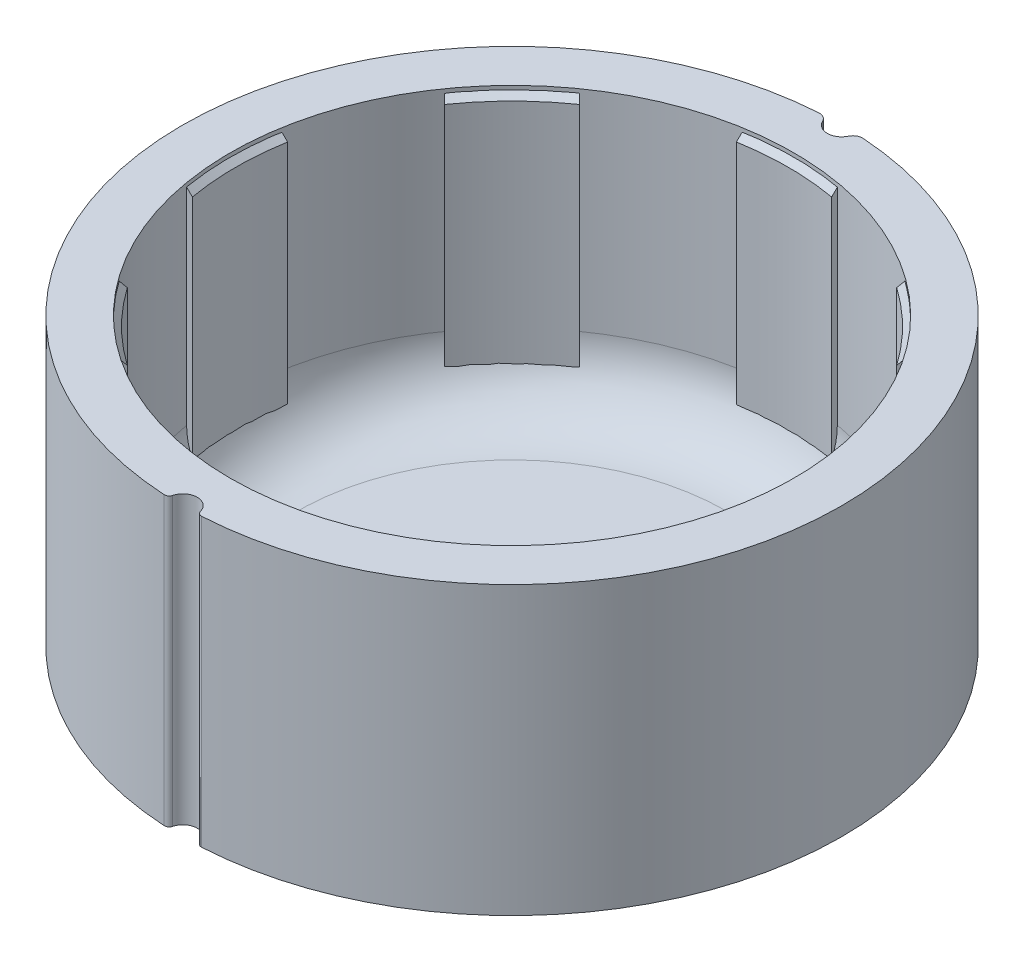
from build123d import *

# Parameters (mm, degrees)
BOSS_EXTRUDE1_DEPTH = 30
CUT_EXTRUDE2_REACH  = 60.241
CUT_EXTRUDE2_START  = 1
SKETCH2_R           = 29.5
BOSS_EXTRUDE2_DEPTH = 30
CHAMFER2_SIZE       = 1
CIRPATTERN2_COUNT   = 8
FILLET2_R           = 7


with BuildPart() as part:
    # Sketch1 → Boss-Extrude1 (new body)
    with BuildSketch(Plane(origin=(0, 0, 0), x_dir=(1, 0, 0), z_dir=(0, 1, 0))):
        with BuildLine():
            ThreePointArc((1.451818925, -34.068556857), (1.641248992, -34.346908706), (1.964225605, -34.442038138))
            ThreePointArc((1.964225605, -34.442038138), (34.499528846, -0.178302888), (2.324135821, 34.423627607))
            ThreePointArc((2.324135821, 34.423627607), (1.751838249, 34.289058819), (1.354061739, 33.856153382))
            ThreePointArc((1.354061739, 33.856153382), (0, 33.001534515), (-1.354061739, 33.856153382))
            ThreePointArc((-1.354061739, 33.856153382), (-1.751838249, 34.289058819), (-2.324135821, 34.423627607))
            ThreePointArc((-2.324135821, 34.423627607), (-34.499528846, -0.178302888), (-1.964225605, -34.442038138))
            ThreePointArc((-1.964225605, -34.442038138), (-1.641248992, -34.346908706), (-1.451818925, -34.068556857))
            ThreePointArc((-1.451818925, -34.068556857), (0, -32.945679925), (1.451818925, -34.068556857))
        make_face()
    extrude(amount=BOSS_EXTRUDE1_DEPTH)

    # Sketch2 → Cut-Extrude2 (cut, up to next)
    with BuildSketch(Plane(origin=(0, 0, 0), x_dir=(1, 0, 0), z_dir=(0, 1, 0)).offset(CUT_EXTRUDE2_START), mode=Mode.PRIVATE) as cut_extrude2_sk1:
        with Locations(Location((0, 0, 0), (0, 0, 270))):
            Circle(SKETCH2_R)
    cut_extrude2_tool1 = extrude(cut_extrude2_sk1.sketch, amount=CUT_EXTRUDE2_REACH, mode=Mode.PRIVATE) & part.part
    add(cut_extrude2_tool1.solids().sort_by_distance((0, 1, 0))[0], mode=Mode.SUBTRACT)

    # Fillet2
    fillet2_edges = [part.edges().sort_by_distance(p)[0] for p in [
        (0, 1, -29.5),
    ]]
    fillet(fillet2_edges, radius=FILLET2_R)


with BuildPart() as body_2:
    # Sketch2<2> → Boss-Extrude2 (new body)
    with BuildSketch(Plane(origin=(0, 0, 0), x_dir=(1, 0, 0), z_dir=(0, 1, 0))):
        with BuildLine():
            ThreePointArc((4.982013036, 29.076271186), (0, 29.5), (-4.982013036, 29.076271186))
            Line((-4.982013036, 29.076271186), (-4.982013036, 28.467341746))
            ThreePointArc((-4.982013036, 28.467341746), (0, 28.9), (4.982013036, 28.467341746))
            Line((4.982013036, 28.467341746), (4.982013036, 29.076271186))
        make_face()
    extrude(amount=BOSS_EXTRUDE2_DEPTH)

    # Chamfer2
    # the kernel refuses this chamfer: 1 mm, written as the material it takes off along each edge
    with BuildSketch(Plane(origin=(0, 30, 0), x_dir=(-0.25924534785409165, 0, -0.9658114979725655), z_dir=(-0.9658114979725655, 0, 0.25924534785409165))) as chamfer2_piece_1:
        Polygon((28.9, CHAMFER2_SIZE), (28.9 + CHAMFER2_SIZE, 0), (28.9, 0), align=None)
    revolve(axis=Axis((0, 30, 0), (0, -1, 0)), revolution_arc=30.050576955, mode=Mode.SUBTRACT)


with BuildPart() as cirpattern2_1:
    # CirPattern2: pattern copy
    add(body_2.part.rotate(Axis((0, 0, 0), (0, 1, 0)), 1 * 360 / CIRPATTERN2_COUNT))


with BuildPart() as cirpattern2_2:
    # CirPattern2: pattern copy
    add(body_2.part.rotate(Axis((0, 0, 0), (0, 1, 0)), 2 * 360 / CIRPATTERN2_COUNT))


with BuildPart() as cirpattern2_3:
    # CirPattern2: pattern copy
    add(body_2.part.rotate(Axis((0, 0, 0), (0, 1, 0)), 3 * 360 / CIRPATTERN2_COUNT))


with BuildPart() as cirpattern2_4:
    # CirPattern2: pattern copy
    add(body_2.part.rotate(Axis((0, 0, 0), (0, 1, 0)), 4 * 360 / CIRPATTERN2_COUNT))


with BuildPart() as cirpattern2_5:
    # CirPattern2: pattern copy
    add(body_2.part.rotate(Axis((0, 0, 0), (0, 1, 0)), 5 * 360 / CIRPATTERN2_COUNT))


with BuildPart() as cirpattern2_6:
    # CirPattern2: pattern copy
    add(body_2.part.rotate(Axis((0, 0, 0), (0, 1, 0)), 6 * 360 / CIRPATTERN2_COUNT))


with BuildPart() as cirpattern2_7:
    # CirPattern2: pattern copy
    add(body_2.part.rotate(Axis((0, 0, 0), (0, 1, 0)), 7 * 360 / CIRPATTERN2_COUNT))


solid = Compound([part.part, body_2.part, cirpattern2_1.part, cirpattern2_2.part, cirpattern2_3.part, cirpattern2_4.part, cirpattern2_5.part, cirpattern2_6.part, cirpattern2_7.part])
